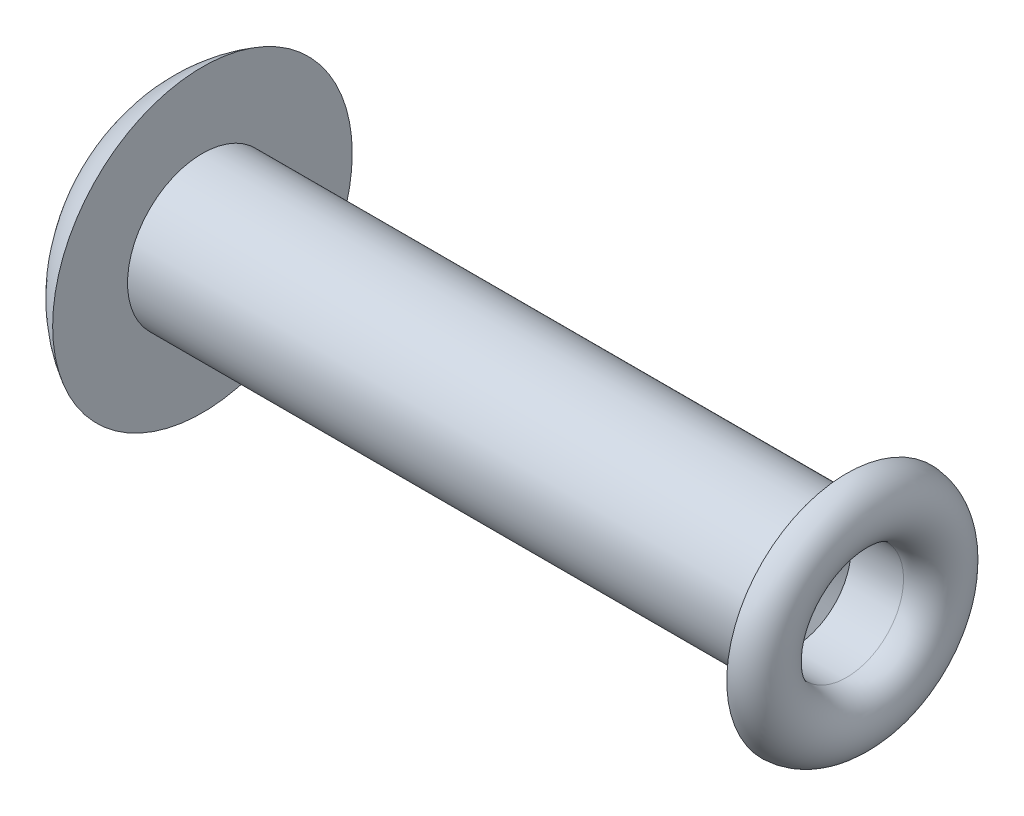
from build123d import *


with BuildPart() as part:
    # Sketch1 → Base-Revolve (revolve)
    with BuildSketch(Plane.XY):
        with BuildLine():
            Line((0, 8), (0, 6.794144144))
            ThreePointArc((0, 6.794144144), (0.796034843, 5.848666431), (-0.1025, 5))
            Line((-0.1025, 5), (-43, 5))
            Line((-43, 5), (-43, 10))
            ThreePointArc((-43, 10), (-46.218807741, 6.847700542), (-47.4, 2.5))
            Line((-47.4, 2.5), (-47.4, 0))
            Line((-47.4, 0), (-5.783270352, 0))
            Line((-5.783270352, 0), (-3.5, 3.8))
            Line((-3.5, 3.8), (0, 3.8))
            ThreePointArc((0, 3.8), (2, 5.9), (0, 8))
        make_face()
    revolve(axis=Axis((40.376928104, 0, 0), (-1, 0, 0)))


solid = part.part
